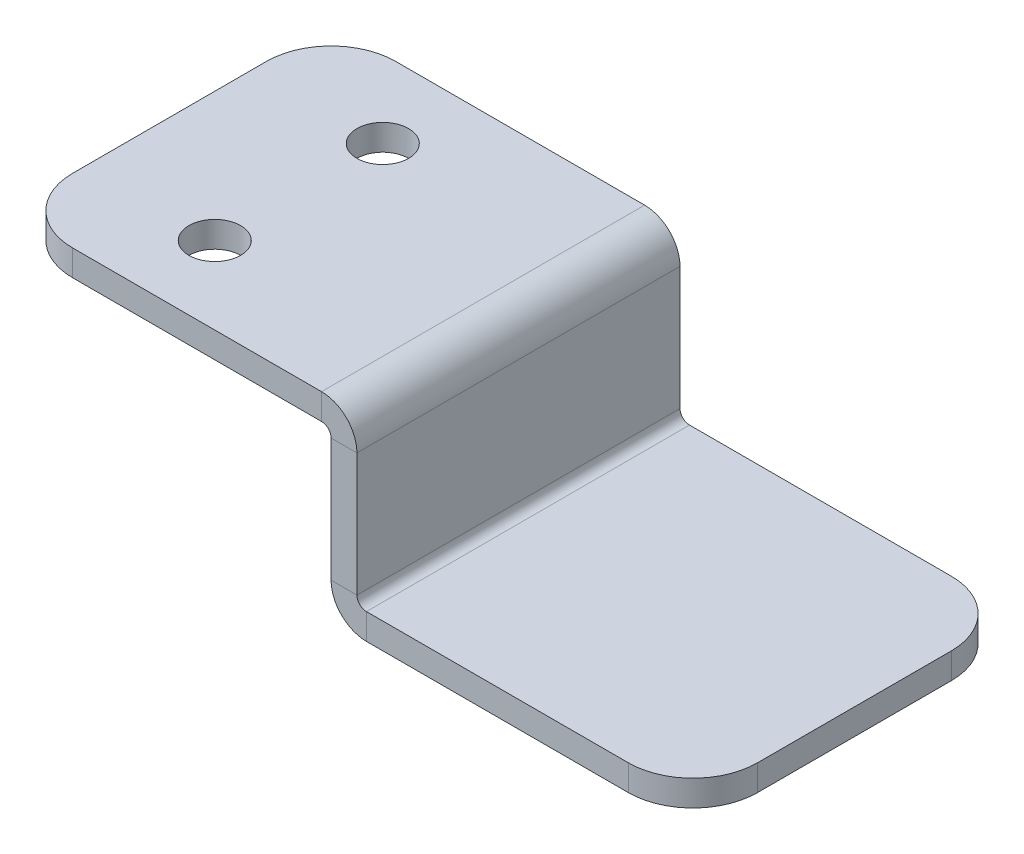
from build123d import *

# Parameters (mm, degrees)
TABAN_FLAN_1_DEPTH    = 12.5
K_ELERI_START         = -13
K_ELERI_K_R1_DEPTH    = 15
IZIM2_R               = 2
KES_EKSTR_ZYON1_DEPTH = 10


# Read off the part's stored shape, not the designer's step: Köşeleri kır1
# Sheet-metal steps are written as plain solids
with BuildPart() as part:
    # Çizim1 → Taban-Flanş1 (new, symmetric)
    with BuildSketch(Plane.XY):
        with BuildLine():
            Line((53, -13), (27.7366, -13))
            ThreePointArc((27.7366, -13), (25.801531583, -12.198468417), (25, -10.2634))
            Line((25, -10.2634), (25, -0.7366))
            ThreePointArc((25, -0.7366), (24.784254855, -0.215745145), (24.2634, 0))
            Line((24.2634, 0), (0, 0))
            Line((0, 0), (0, 2))
            Line((0, 2), (24.2634, 2))
            ThreePointArc((24.2634, 2), (26.198468417, 1.198468417), (27, -0.7366))
            Line((27, -0.7366), (27, -10.2634))
            ThreePointArc((27, -10.2634), (27.215745145, -10.784254855), (27.7366, -11))
            Line((27.7366, -11), (53, -11))
            Line((53, -11), (53, -13))
        make_face()
    extrude(amount=TABAN_FLAN_1_DEPTH, both=True)

    # Köşeleri kır1 outline → Köşeleri kır1 (cut)
    with BuildSketch(Plane(origin=(0, 0, 0), x_dir=(1, 0, 0), z_dir=(0, 1, 0)).offset(K_ELERI_START)):
        with BuildLine():
            Line((53, 12.5), (48, 12.5))
            ThreePointArc((48, 12.5), (51.535533906, 11.035533906), (53, 7.5))
            Line((53, 7.5), (53, 12.5))
        make_face()
        with BuildLine():
            Line((53, -12.5), (53, -7.5))
            ThreePointArc((53, -7.5), (51.535533906, -11.035533906), (48, -12.5))
            Line((48, -12.5), (53, -12.5))
        make_face()
        with BuildLine():
            ThreePointArc((5, -12.5), (1.464466094, -11.035533906), (0, -7.5))
            Line((0, -7.5), (0, -12.5))
            Line((0, -12.5), (5, -12.5))
        make_face()
        with BuildLine():
            ThreePointArc((0, 7.5), (1.464466094, 11.035533906), (5, 12.5))
            Line((5, 12.5), (0, 12.5))
            Line((0, 12.5), (0, 7.5))
        make_face()
    extrude(amount=K_ELERI_K_R1_DEPTH, mode=Mode.SUBTRACT)

    # Çizim2 → Kes-Ekstrüzyon1 (cut)
    with BuildSketch(Plane(origin=(0, 2, 0), x_dir=(1, 0, 0), z_dir=(0, 1, 0))):
        with Locations(Location((10, 6.5, 0), (0, 0, 180))):
            Circle(IZIM2_R)
        with Locations((10, -6.5)):
            Circle(IZIM2_R)
    extrude(amount=-KES_EKSTR_ZYON1_DEPTH, mode=Mode.SUBTRACT)


solid = part.part
